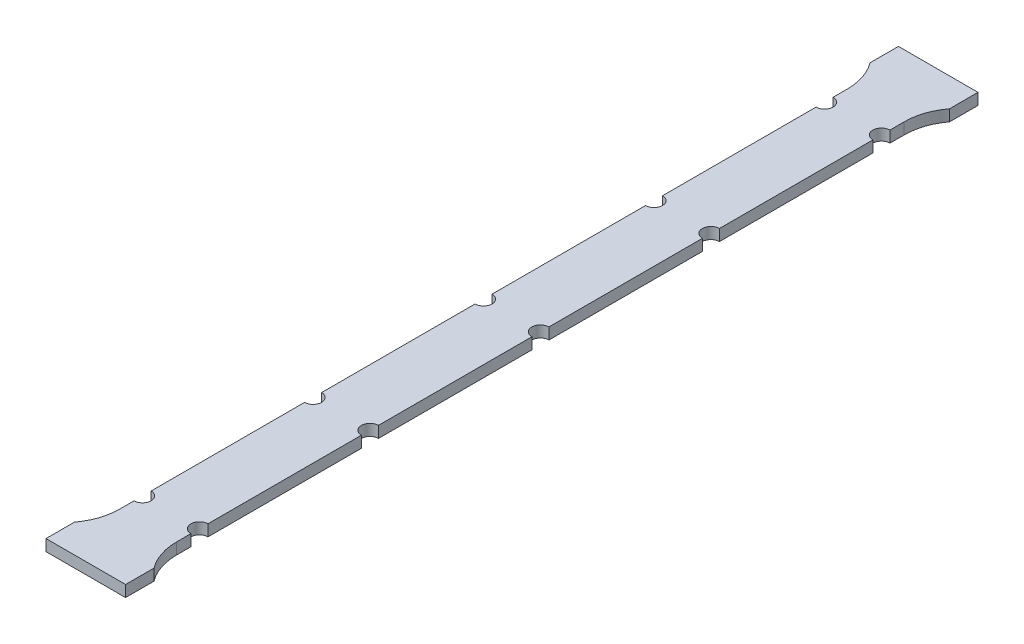
from build123d import *

# Parameters (mm, degrees)
SKETCH_1_W      = 2
SKETCH_1_H      = 5
EXTRUDE_1_DEPTH = 2
FILLET_1_R      = 10


with BuildPart() as part:
    # 草图1 → 凸台-拉伸1 (new body)
    with BuildSketch(Plane(origin=(0, 0, 0), x_dir=(1, 0, 0), z_dir=(0, 1, 0))):
        with BuildLine():
            Line((10, 0), (0, 0))
            Line((0, 0), (0, -5))
            Line((0, -5), (0, -13.5))
            ThreePointArc((0, -13.5), (1.060660172, -13.939339828), (1.5, -15))
            ThreePointArc((1.5, -15), (1.060660172, -16.060660172), (0, -16.5))
            Line((0, -16.5), (0, -43.5))
            ThreePointArc((0, -43.5), (1.060660172, -43.939339828), (1.5, -45))
            ThreePointArc((1.5, -45), (1.060660172, -46.060660172), (0, -46.5))
            Line((0, -46.5), (0, -73.5))
            ThreePointArc((0, -73.5), (1.060660172, -73.939339828), (1.5, -75))
            Line((1.5, -75), (2.5, -75))
            Line((2.5, -75), (2.5, -72.5))
            Line((2.5, -72.5), (7.5, -72.5))
            Line((7.5, -72.5), (7.5, -75))
            Line((7.5, -75), (8.5, -75))
            ThreePointArc((8.5, -75), (8.939339828, -73.939339828), (10, -73.5))
            Line((10, -73.5), (10, -46.5))
            ThreePointArc((10, -46.5), (8.5, -45), (10, -43.5))
            Line((10, -43.5), (10, -16.5))
            ThreePointArc((10, -16.5), (8.5, -15), (10, -13.5))
            Line((10, -13.5), (10, -5))
            Line((10, -5), (10, 0))
        make_face()
        Polygon((2.5, -72.5), (2.5, -75), (5, -75), (7.5, -75), (7.5, -72.5), align=None)
        Polygon((5, -75), (2.5, -75), (2.5, -77.5), (7.5, -77.5), (7.5, -75), align=None)
        with BuildLine():
            Line((2.5, -75), (1.5, -75))
            ThreePointArc((1.5, -75), (1.060660172, -76.060660172), (0, -76.5))
            Line((0, -76.5), (0, -103.5))
            ThreePointArc((0, -103.5), (1.060660172, -103.939339828), (1.5, -105))
            ThreePointArc((1.5, -105), (1.060660172, -106.060660172), (0, -106.5))
            Line((0, -106.5), (0, -133.5))
            ThreePointArc((0, -133.5), (1.060660172, -133.939339828), (1.5, -135))
            ThreePointArc((1.5, -135), (1.060660172, -136.060660172), (0, -136.5))
            Line((0, -136.5), (0, -145))
            Line((0, -145), (0, -150))
            Line((0, -150), (10, -150))
            Line((10, -150), (10, -145))
            Line((10, -145), (10, -136.5))
            ThreePointArc((10, -136.5), (8.5, -135), (10, -133.5))
            Line((10, -133.5), (10, -106.5))
            ThreePointArc((10, -106.5), (8.5, -105), (10, -103.5))
            Line((10, -103.5), (10, -76.5))
            ThreePointArc((10, -76.5), (8.939339828, -76.060660172), (8.5, -75))
            Line((8.5, -75), (7.5, -75))
            Line((7.5, -75), (7.5, -77.5))
            Line((7.5, -77.5), (2.5, -77.5))
            Line((2.5, -77.5), (2.5, -75))
        make_face()
        with Locations((11, -147.5)):
            Rectangle(SKETCH_1_W, SKETCH_1_H)
        with Locations((-1, -147.5)):
            Rectangle(SKETCH_1_W, SKETCH_1_H)
        with Locations((11, -2.5)):
            Rectangle(SKETCH_1_W, SKETCH_1_H)
        with Locations((-1, -2.5)):
            Rectangle(SKETCH_1_W, SKETCH_1_H)
    extrude(amount=EXTRUDE_1_DEPTH)

    # 圆角1
    # the kernel refuses this fillet: 10 mm, written as the material it adds along each edge
    with BuildSketch(Plane(origin=(10, 0, 145), x_dir=(0, 0, -1), z_dir=(0, 1, 0)), Plane(origin=(0, 0, 5), x_dir=(0, 0, 1), z_dir=(0, 1, 0))) as fillet_1_piece_1:
        with BuildLine():
            CenterArc((6, -10), FILLET_1_R, 90, 36.869897646)
            Line((0, -2), (0, 0))
            Line((0, 0), (6, 0))
        make_face()
    extrude(amount=2)
    with BuildSketch(Plane(origin=(0, 0, 145), x_dir=(-1, 0, 0), z_dir=(0, 1, 0)), Plane(origin=(10, 0, 5), x_dir=(1, 0, 0), z_dir=(0, 1, 0))) as fillet_1_piece_2:
        with BuildLine():
            CenterArc((10, -6), FILLET_1_R, 143.130102354, 36.869897646)
            Line((0, -6), (0, 0))
            Line((0, 0), (2, 0))
        make_face()
    extrude(amount=2)


solid = part.part
